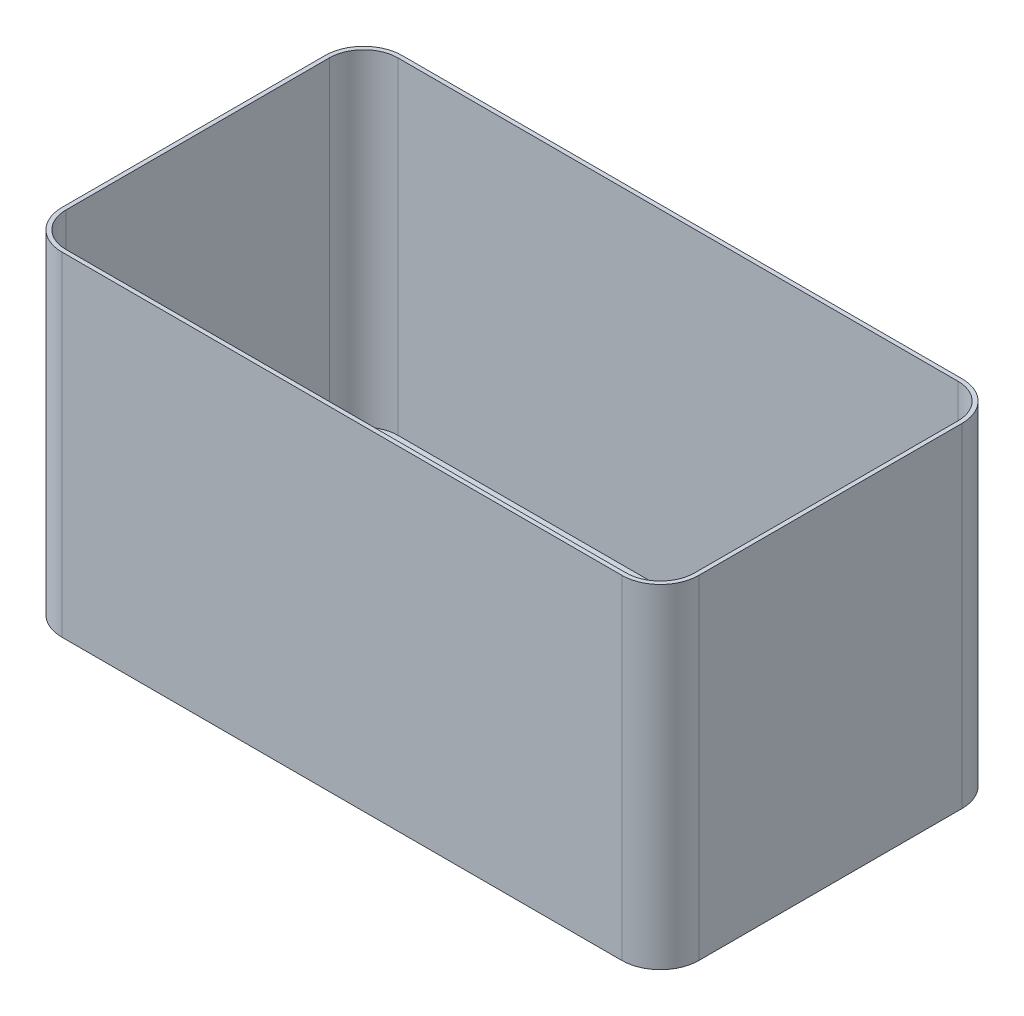
from build123d import *

# Parameters (mm, degrees)
EXTRUDE_1_DEPTH     = 199
CUT_EXTRUDE_1_DEPTH = 195


with BuildPart() as part:
    # 草图1 → 凸台-拉伸1 (new body)
    with BuildSketch(Plane(origin=(0, 0, 0), x_dir=(1, 0, 0), z_dir=(0, 1, 0))):
        with BuildLine():
            Line((-167, 101.5), (167, 101.5))
            ThreePointArc((167, 101.5), (183.263455967, 94.763455967), (190, 78.5))
            Line((190, 78.5), (190, -78.5))
            ThreePointArc((190, -78.5), (183.263455967, -94.763455967), (167, -101.5))
            Line((167, -101.5), (-167, -101.5))
            ThreePointArc((-167, -101.5), (-183.263455967, -94.763455967), (-190, -78.5))
            Line((-190, -78.5), (-190, 78.5))
            ThreePointArc((-190, 78.5), (-183.263455967, 94.763455967), (-167, 101.5))
        make_face()
    extrude(amount=EXTRUDE_1_DEPTH)

    # 草图3 → 切除-拉伸1 (cut)
    with BuildSketch(Plane(origin=(0, 199, 0), x_dir=(1, 0, 0), z_dir=(0, 1, 0))):
        with BuildLine():
            Line((-167, 99), (167, 99))
            ThreePointArc((167, 99), (181.495689014, 92.995689014), (187.5, 78.5))
            Line((187.5, 78.5), (187.5, -78.5))
            ThreePointArc((187.5, -78.5), (181.495689014, -92.995689014), (167, -99))
            Line((167, -99), (-167, -99))
            ThreePointArc((-167, -99), (-181.495689014, -92.995689014), (-187.5, -78.5))
            Line((-187.5, -78.5), (-187.5, 78.5))
            ThreePointArc((-187.5, 78.5), (-181.495689014, 92.995689014), (-167, 99))
        make_face()
    extrude(amount=-CUT_EXTRUDE_1_DEPTH, mode=Mode.SUBTRACT)


solid = part.part
